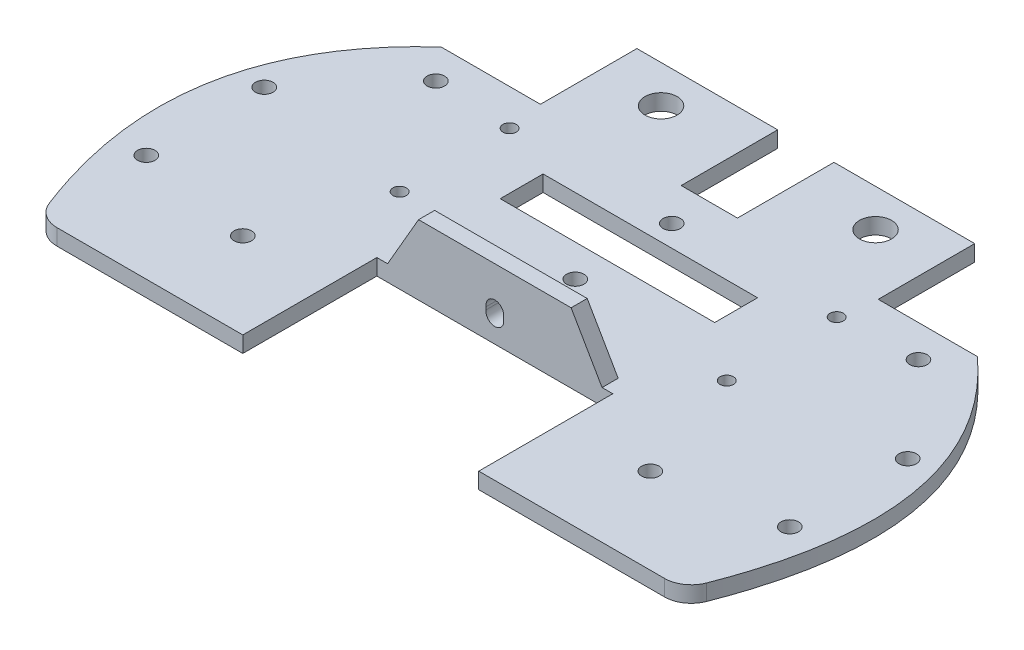
from build123d import *

# Parameters (mm, degrees)
SKETCH1_W           = 26.25
SKETCH1_H           = 22
SKETCH1_R           = 3
BOSS_EXTRUDE1_DEPTH = 3
FILLET1_R           = 5
SKETCH2_R           = 1.625
CUT_EXTRUDE1_DEPTH  = 3
SKETCH5_W           = 20
SKETCH5_H           = 3
BOSS_EXTRUDE2_DEPTH = 10
SKETCH6_R           = 1.65
CUT_EXTRUDE4_DEPTH  = 28
CHAMFER1_SIZE       = 10
CHAMFER1_SIZE_2     = 17.320508076
SKETCH9_W           = 20
SKETCH9_H           = 5
CUT_EXTRUDE6_DEPTH  = 3
FILLET3_R           = 5
SKETCH16_W          = 40
SKETCH16_H          = 8
CUT_EXTRUDE11_DEPTH = 10
SKETCH17_R          = 1.25
CUT_EXTRUDE12_DEPTH = 10
SKETCH18_W          = 114.543980026
SKETCH18_H          = 4
CUT_EXTRUDE13_DEPTH = 10
SKETCH3_R           = 1.625
CUT_EXTRUDE14_DEPTH = 10


# Some blends are built 0.0001 mm under size
with BuildPart() as part:
    # Sketch1 → Boss-Extrude1 (new body)
    # profile 1 of 3: a face of its own
    with BuildSketch(Plane(origin=(0, 0, 0), x_dir=(1, 0, 0), z_dir=(0, 1, 0))):
        with Locations((18.375, 0)):
            Rectangle(SKETCH1_W, SKETCH1_H)
        with Locations(Location((20, 0, 0), (0, 0, 270))):
            Circle(SKETCH1_R, mode=Mode.SUBTRACT)
    # profile 2 of 3: a face of its own
    with BuildSketch(Plane(origin=(0, 0, 0), x_dir=(1, 0, 0), z_dir=(0, 1, 0))):
        with Locations((-18.375, 0)):
            Rectangle(SKETCH1_W, SKETCH1_H)
        with Locations(Location((-20, 0, 0), (0, 0, 270))):
            Circle(SKETCH1_R, mode=Mode.SUBTRACT)
    # profile 3 of 3: a face of its own
    with BuildSketch(Plane(origin=(0, 0, 0), x_dir=(1, 0, 0), z_dir=(0, 1, 0))):
        with BuildLine():
            Line((-5.25, -11), (-31.5, -11))
            Line((-31.5, -11), (-50, -11))
            add(Edge.make_bspline(
                [(-50, -11), (-77.2307176, -35.658609428), (-60, -76)],
                knots=[0, 0, 0, 1, 1, 1], degree=2))
            Line((-60, -76), (-22, -76))
            Line((-22, -76), (-22, -51))
            Line((-22, -51), (22, -51))
            Line((22, -51), (22, -76))
            Line((22, -76), (60, -76))
            add(Edge.make_bspline(
                [(50, -11), (77.2307176, -35.658609428), (60, -76)],
                knots=[0, 0, 0, 1, 1, 1], degree=2))
            Line((50, -11), (31.5, -11))
            Line((31.5, -11), (5.25, -11))
            Line((5.25, -11), (-5.25, -11))
        make_face()
    extrude(amount=BOSS_EXTRUDE1_DEPTH)

    # Fillet1
    fillet1_edges = [part.edges().sort_by_distance(p)[0] for p in [
        (60, 1.5, 76),
        (-60, 1.5, 76),
    ]]
    fillet(fillet1_edges, radius=FILLET1_R)

    # Sketch2 → Cut-Extrude1 (cut)
    with BuildSketch(Plane(origin=(0, 3, 0), x_dir=(1, 0, 0), z_dir=(0, 1, 0))):
        with Locations(Location((-60, -56, 0), (0, 0, 270))):
            Circle(SKETCH2_R)
        with Locations(Location((60, -56, 0), (0, 0, 270))):
            Circle(SKETCH2_R)
        with Locations(Location((-45, -17, 0), (0, 0, 270))):
            Circle(SKETCH2_R)
        with Locations(Location((-60, -34, 0), (0, 0, 270))):
            Circle(SKETCH2_R)
        with Locations(Location((60, -34, 0), (0, 0, 270))):
            Circle(SKETCH2_R)
        with Locations(Location((45, -17, 0), (0, 0, 270))):
            Circle(SKETCH2_R)
        with Locations(Location((0, -18, 0), (0, 0, 270))):
            Circle(SKETCH2_R)
        with Locations(Location((0, -36, 0), (0, 0, 270))):
            Circle(SKETCH2_R)
    extrude(amount=-CUT_EXTRUDE1_DEPTH, mode=Mode.SUBTRACT)

    # Sketch5 → Boss-Extrude2 (add)
    with BuildSketch(Plane(origin=(0, 3, 0), x_dir=(1, 0, 0), z_dir=(0, 1, 0))):
        with Locations((0, -49.5)):
            Rectangle(SKETCH5_W, SKETCH5_H)
    extrude(amount=BOSS_EXTRUDE2_DEPTH)

    # Sketch6 → Cut-Extrude4 (cut)
    with BuildSketch(Plane.XY.offset(76)):
        with Locations((0, 5)):
            Circle(SKETCH6_R)
        with Locations((0, 5.5)):
            Circle(SKETCH6_R)
        with Locations((0, 4.5)):
            Circle(SKETCH6_R)
    extrude(amount=-CUT_EXTRUDE4_DEPTH, mode=Mode.SUBTRACT)

    # Chamfer1
    # the kernel refuses this chamfer: 17.320508076, 10 mm, written as the material it adds along each edge
    with BuildSketch(Plane(origin=(-10, 3, 51), x_dir=(-0.9983227437537926, -0.05789386240267139, 0), z_dir=(0, 0, -1))) as chamfer1_piece_1_section:
        Polygon((CHAMFER1_SIZE * 0.998322743754, CHAMFER1_SIZE * 0.0578938624027), (-CHAMFER1_SIZE_2 * 0.0578938624016, CHAMFER1_SIZE_2 * 0.998322743736), (0, 0), align=None)
    chamfer1_piece_1 = extrude(amount=3, mode=Mode.PRIVATE)
    chamfer1_piece_1 = split(chamfer1_piece_1, bisect_by=Plane(origin=(-13.731694811, 13, 49.5), z_dir=(0, -1, 0)), keep=Keep.TOP, mode=Mode.PRIVATE)
    add(chamfer1_piece_1)
    with BuildSketch(Plane(origin=(10, 3, 48), x_dir=(0.9983227437537926, -0.05789386240267137, 0), z_dir=(0, 0, 1))) as chamfer1_piece_2_section:
        Polygon((CHAMFER1_SIZE * 0.998322743754, CHAMFER1_SIZE * 0.0578938624027), (-CHAMFER1_SIZE_2 * 0.0578938624016, CHAMFER1_SIZE_2 * 0.998322743736), (0, 0), align=None)
    chamfer1_piece_2 = extrude(amount=3, mode=Mode.PRIVATE)
    chamfer1_piece_2 = split(chamfer1_piece_2, bisect_by=Plane(origin=(13.731694811, 13, 49.5), z_dir=(0, -1, 0)), keep=Keep.TOP, mode=Mode.PRIVATE)
    add(chamfer1_piece_2)

    # Sketch9 → Cut-Extrude6 (cut)
    with BuildSketch(Plane(origin=(0, 3, 0), x_dir=(1, 0, 0), z_dir=(0, 1, 0))):
        with Locations((0, -45.5)):
            Rectangle(SKETCH9_W, SKETCH9_H)
    extrude(amount=-CUT_EXTRUDE6_DEPTH, mode=Mode.SUBTRACT)

    # Fillet3
    fillet3_edges = [part.edges().sort_by_distance(p)[0] for p in [
        (-10, 1.5, 43),
        (10, 1.5, 43),
    ]]
    fillet(fillet3_edges, radius=FILLET3_R - 0.0001)  # a hair under: the kernel refuses the full size

    # Sketch16 → Cut-Extrude11 (cut)
    with BuildSketch(Plane(origin=(0, 3, 0), x_dir=(1, 0, 0), z_dir=(0, 1, 0))):
        with Locations((0, -26)):
            Rectangle(SKETCH16_W, SKETCH16_H)
    extrude(amount=-CUT_EXTRUDE11_DEPTH, mode=Mode.SUBTRACT)

    # Sketch17 → Cut-Extrude12 (cut)
    with BuildSketch(Plane(origin=(0, 3, 0), x_dir=(1, 0, 0), z_dir=(0, 1, 0))):
        with Locations(Location((-30.5, -17.75, 0), (0, 0, 270))):
            Circle(SKETCH17_R)
        with Locations(Location((-30.5, -38.25, 0), (0, 0, 270))):
            Circle(SKETCH17_R)
        with Locations(Location((30.5, -38.25, 0), (0, 0, 270))):
            Circle(SKETCH17_R)
        with Locations(Location((30.5, -17.75, 0), (0, 0, 270))):
            Circle(SKETCH17_R)
    extrude(amount=-CUT_EXTRUDE12_DEPTH, mode=Mode.SUBTRACT)

    # Sketch18 → Cut-Extrude13 (cut)
    with BuildSketch(Plane(origin=(0, 3, 0), x_dir=(1, 0, 0), z_dir=(0, 1, 0))):
        with Locations((-4.144236525, 9)):
            Rectangle(SKETCH18_W, SKETCH18_H)
    extrude(amount=-CUT_EXTRUDE13_DEPTH, mode=Mode.SUBTRACT)

    # Sketch3 → Cut-Extrude14 (cut)
    with BuildSketch(Plane(origin=(0, 3, 0), x_dir=(1, 0, 0), z_dir=(0, 1, 0))):
        with Locations(Location((-38, -60, 0), (0, 0, 270))):
            Circle(SKETCH3_R)
        with Locations(Location((38, -60, 0), (0, 0, 270))):
            Circle(SKETCH3_R)
    extrude(amount=-CUT_EXTRUDE14_DEPTH, mode=Mode.SUBTRACT)


solid = part.part
